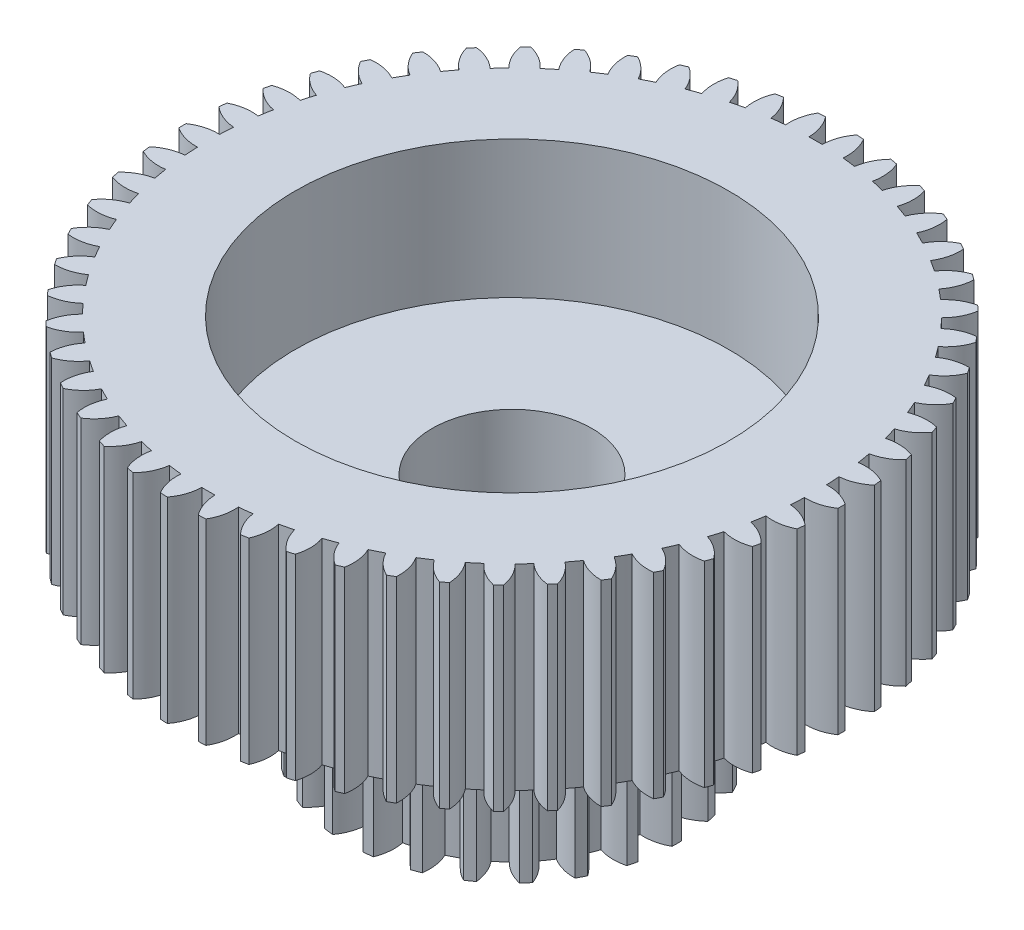
from build123d import *

# Parameters (mm, degrees)
SKIZZE1_R                       = 8.4
SKIZZE1_R_2                     = 4.075
AUFSATZ_LINEAR_AUSTRAGEN1_DEPTH = 9.1
SKIZZE2_R                       = 16.8
SKIZZE2_R_2                     = 4.075
AUFSATZ_LINEAR_AUSTRAGEN2_DEPTH = 10
SKIZZE3_R                       = 11.05
SCHNITT_LINEAR_AUSTRAGEN1_DEPTH = 7
SCHNITT_LINEAR_START            = -10
SCHNITT_LINEAR_AUSTRAGEN2_DEPTH = 10
KREISMUSTER1_COUNT              = 54
SCHNITT_LINEAR_AUSTRAGEN3_DEPTH = 9.1
KREISMUSTER2_COUNT              = 26


with BuildPart() as part:
    # Skizze1 → Aufsatz-Linear austragen1 (new body)
    with BuildSketch(Plane(origin=(0, 0, 0), x_dir=(1, 0, 0), z_dir=(0, 1, 0))):
        with Locations(Location((0, 0, 0), (0, 0, 270))):
            Circle(SKIZZE1_R)
        with Locations(Location((0, 0, 0), (0, 0, 270))):
            Circle(SKIZZE1_R_2, mode=Mode.SUBTRACT)
    extrude(amount=AUFSATZ_LINEAR_AUSTRAGEN1_DEPTH)

    # Skizze2 → Aufsatz-Linear austragen2 (add)
    with BuildSketch(Plane(origin=(0, 9.1, 0), x_dir=(1, 0, 0), z_dir=(0, 1, 0))):
        with Locations(Location((0, 0, 0), (0, 0, 270))):
            Circle(SKIZZE2_R)
        with Locations(Location((0, 0, 0), (0, 0, 270))):
            Circle(SKIZZE2_R_2, mode=Mode.SUBTRACT)
    extrude(amount=AUFSATZ_LINEAR_AUSTRAGEN2_DEPTH)

    # Skizze3 → Schnitt-Linear austragen1 (cut)
    with BuildSketch(Plane(origin=(0, 19.1, 0), x_dir=(1, 0, 0), z_dir=(0, 1, 0))):
        with Locations(Location((0, 0, 0), (0, 0, 270))):
            Circle(SKIZZE3_R)
    extrude(amount=-SCHNITT_LINEAR_AUSTRAGEN1_DEPTH, mode=Mode.SUBTRACT)

    # Skizze5 → Schnitt-Linear austragen2 (cut)
    with BuildSketch(Plane(origin=(0, 19.1, 0), x_dir=(1, 0, 0), z_dir=(0, 1, 0)).offset(SCHNITT_LINEAR_START)):
        with BuildLine():
            ThreePointArc((0.336724731, 15.476337307), (0.46108779, 16.164849804), (0.791960149, 16.781322925))
            ThreePointArc((0.791960149, 16.781322925), (0, 16.8), (-0.791960149, 16.781322925))
            ThreePointArc((-0.791960149, 16.781322925), (-0.46108779, 16.164849804), (-0.336724731, 15.476337307))
            ThreePointArc((-0.336724731, 15.476337307), (0, 15.48), (0.336724731, 15.476337307))
        make_face()
    schnitt_linear_austragen2 = extrude(amount=SCHNITT_LINEAR_AUSTRAGEN2_DEPTH, mode=Mode.SUBTRACT)

    # Kreismuster1: Schnitt-Linear austragen2 ×54 about axis
    kreismuster1_axis = Axis((0, 0, 0), (0, 1, 0))
    for i in range(1, KREISMUSTER1_COUNT):
        add(schnitt_linear_austragen2.rotate(kreismuster1_axis, i * 360 / KREISMUSTER1_COUNT), mode=Mode.SUBTRACT)

    # Skizze6 → Schnitt-Linear austragen3 (cut)
    with BuildSketch(Plane.XZ):
        with BuildLine():
            ThreePointArc((0.3280456, 7.072396064), (0.458466617, 7.750622252), (0.775699199, 8.36410729))
            ThreePointArc((0.775699199, 8.36410729), (0, 8.4), (-0.775699199, 8.36410729))
            ThreePointArc((-0.775699199, 8.36410729), (-0.458466617, 7.750622252), (-0.3280456, 7.072396064))
            ThreePointArc((-0.3280456, 7.072396064), (0, 7.08), (0.3280456, 7.072396064))
        make_face()
    schnitt_linear_austragen3 = extrude(amount=-SCHNITT_LINEAR_AUSTRAGEN3_DEPTH, mode=Mode.SUBTRACT)

    # Kreismuster2: Schnitt-Linear austragen3 ×26 about axis
    kreismuster2_axis = Axis((0, 0, 0), (0, 1, 0))
    for i in range(1, KREISMUSTER2_COUNT):
        add(schnitt_linear_austragen3.rotate(kreismuster2_axis, i * 360 / KREISMUSTER2_COUNT), mode=Mode.SUBTRACT)


solid = part.part
